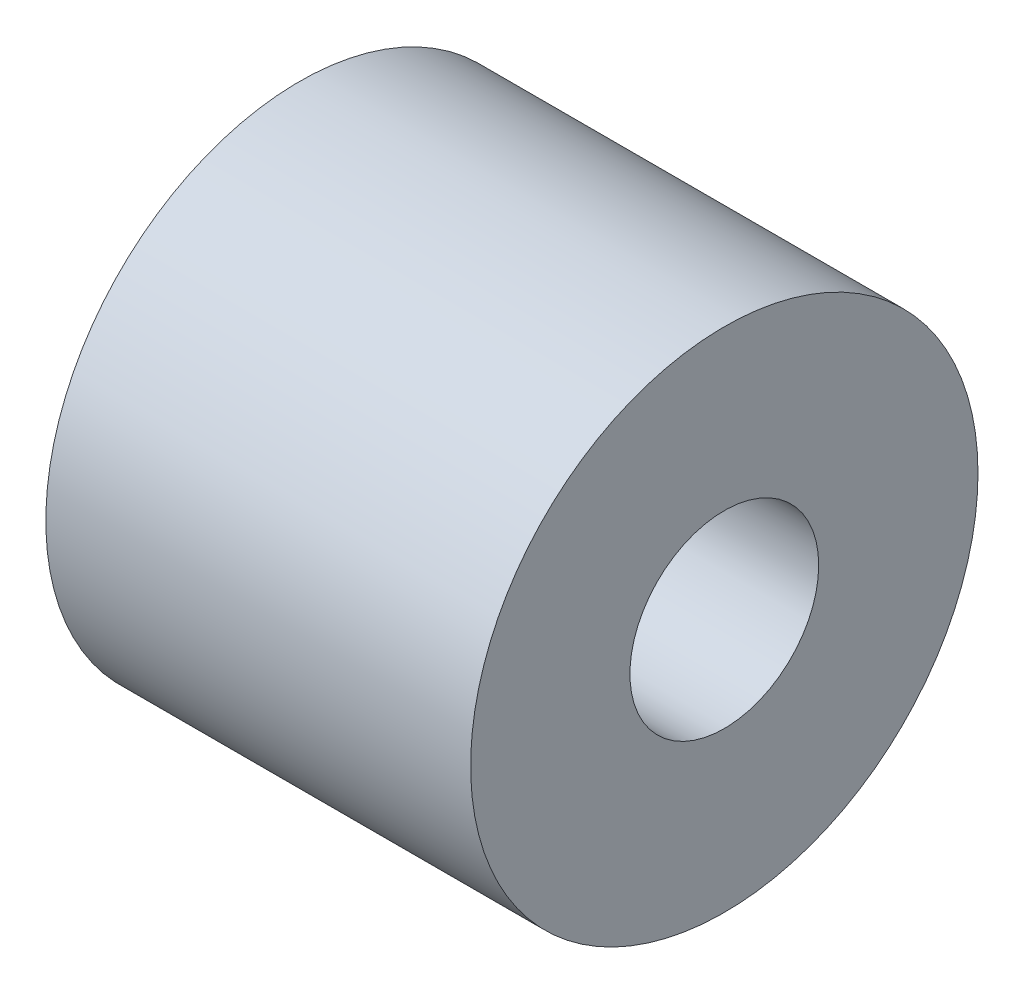
from build123d import *

# Parameters (mm, degrees)
SKETCH1_R           = 10.75
SKETCH1_R_2         = 4
BOSS_EXTRUDE1_DEPTH = 18


with BuildPart() as part:
    # Sketch1 → Boss-Extrude1 (new body)
    with BuildSketch(Plane(origin=(0, 0, 0), x_dir=(0, 0, -1), z_dir=(1, 0, 0))):
        Circle(SKETCH1_R)
        Circle(SKETCH1_R_2, mode=Mode.SUBTRACT)
    extrude(amount=BOSS_EXTRUDE1_DEPTH)


solid = part.part
